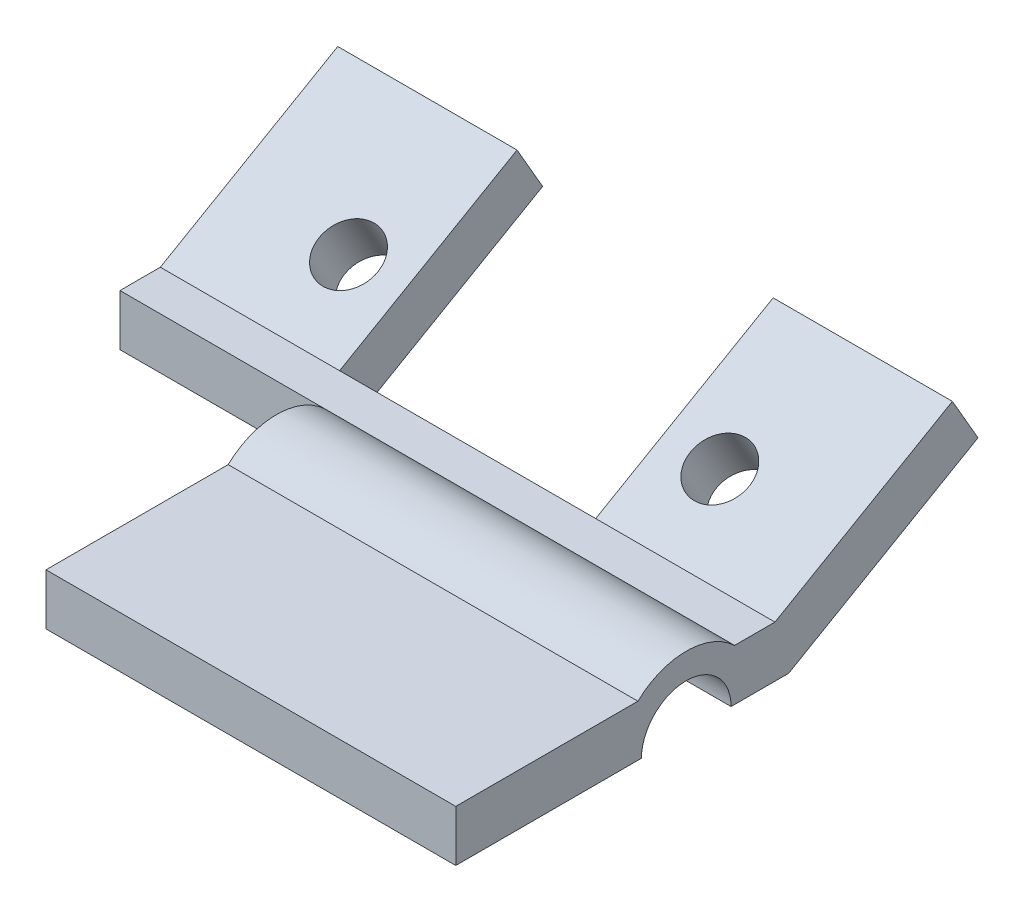
from build123d import *

# Parameters (mm, degrees)
BOSS_EXTRUDE1_DEPTH     = 24
CUT_EXTRUDE1_DEPTH      = 32.746591894
CUT_EXTRUDE1_DEPTH_BACK = 32.746591894
SKETCH2_W               = 8
SKETCH2_H               = 10.887458609
SKETCH3_R               = 1.15
CUT_EXTRUDE2_DEPTH      = 32.671692359
SKETCH4_W               = 10
SKETCH4_H               = 16
CUT_EXTRUDE3_DEPTH      = 20


with BuildPart() as part:
    # Sketch1 → Boss-Extrude1 (new body)
    with BuildSketch(Plane(origin=(0, 0, 0), x_dir=(0, 0, -1), z_dir=(1, 0, 0))):
        with BuildLine():
            ThreePointArc((7.25, 0), (9, 1.75), (10.75, 0))
            Line((10.75, 0), (13, 0))
            Line((13, 0), (20.392304845, 4.267949192))
            Line((20.392304845, 4.267949192), (19.392304845, 6))
            Line((19.392304845, 6), (12.464101615, 2))
            Line((12.464101615, 2), (10.887458609, 2))
            ThreePointArc((10.887458609, 2), (9, 2.75), (7.112541391, 2))
            Line((7.112541391, 2), (0, 2))
            Line((0, 2), (0, 0))
            Line((0, 0), (7.25, 0))
        make_face()
    extrude(amount=BOSS_EXTRUDE1_DEPTH)

    # Sketch2 → Cut-Extrude1 (cut, two sides: drawn at the far end of the back side and taken through both)
    with BuildSketch(Plane(origin=(0, 2, 0), x_dir=(1, 0, 0), z_dir=(0, 1, 0)).offset(-CUT_EXTRUDE1_DEPTH_BACK)):
        with Locations((4, 5.443729305)):
            Rectangle(SKETCH2_W, SKETCH2_H)
    extrude(amount=CUT_EXTRUDE1_DEPTH + CUT_EXTRUDE1_DEPTH_BACK, mode=Mode.SUBTRACT)

    # Sketch3 → Cut-Extrude2 (cut, through all)
    with BuildSketch(Plane(origin=(0, -3.897114317, -2.25), x_dir=(1, 0, 0), z_dir=(0, 0.866025403784438, 0.5000000000000012))):
        with Locations((4.75, 14.794228634)):
            Circle(SKETCH3_R)
        with Locations((19.25, 14.794228634)):
            Circle(SKETCH3_R)
    extrude(amount=-CUT_EXTRUDE2_DEPTH, mode=Mode.SUBTRACT)

    # Sketch4 → Cut-Extrude3 (cut)
    with BuildSketch(Plane(origin=(0, -3.897114317, -2.25), x_dir=(1, 0, 0), z_dir=(0, 0.866025403784438, 0.5000000000000012))):
        with Locations((12, 19.794228634)):
            Rectangle(SKETCH4_W, SKETCH4_H)
    extrude(amount=-CUT_EXTRUDE3_DEPTH, mode=Mode.SUBTRACT)


solid = part.part
